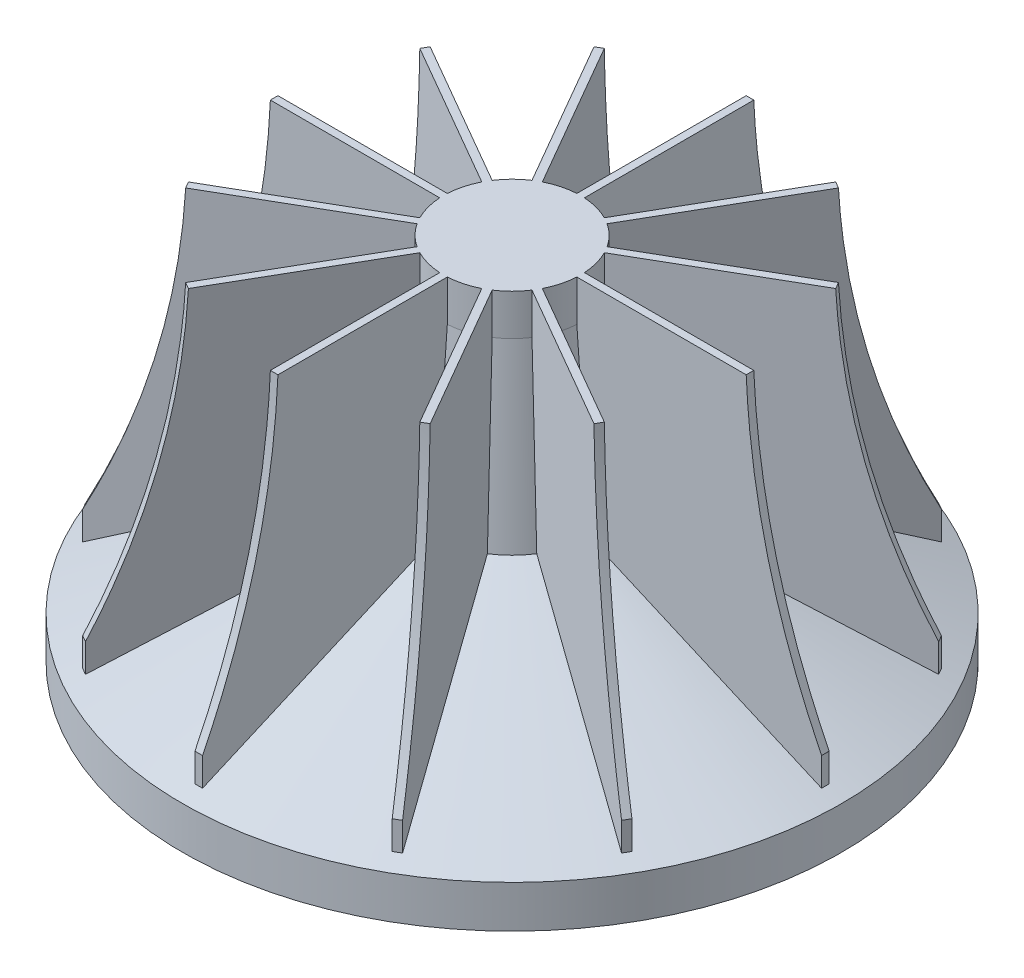
from build123d import *

# Parameters (mm, degrees)
BOSS_EXTRUDE5_REACH = 73.526
CIRPATTERN8_COUNT   = 12


with BuildPart() as part:
    # Sketch1 → Revolve1 (revolve)
    with BuildSketch(Plane.XY):
        Polygon((0, 0), (-39.624, 0), (-39.624, 5.08), (-9.822923796, 18.069281233), (-8.255, 39.518150017), (-8.255, 44.45), (0, 44.45), align=None)
    revolve(axis=Axis((0, 0, 0), (0, 1, 0)))

    # Sketch3 → Boss-Extrude5 (add, up to next)
    with BuildSketch(Plane(origin=(0, 44.45, 0), x_dir=(1, 0, 0), z_dir=(0, 1, 0)), mode=Mode.PRIVATE) as boss_extrude5_sk1:
        with BuildLine():
            Line((0.455930282, -37.670191496), (0.455991802, -8.206191496))
            add(Edge.make_bspline(
                [(-0.45593, -8.206191496), (3.0201e-05, -8.303808504), (0.455991802, -8.206191496)],
                knots=[0, 0, 0, 1, 1, 1], degree=2))
            Line((-0.45593, -8.206191496), (-0.45593, -37.670191496))
            Line((-0.45593, -37.670191496), (0.455930282, -37.670191496))
        make_face()
    boss_extrude5_tool1 = extrude(boss_extrude5_sk1.sketch, amount=-BOSS_EXTRUDE5_REACH, mode=Mode.PRIVATE) - part.part
    boss_extrude5 = boss_extrude5_tool1.solids().sort_by_distance((1.6e-05, 44.45, 22.954292))[0]
    add(boss_extrude5)

    # CirPattern8: Boss-Extrude5 ×12 about axis
    cirpattern8_axis = Axis((0, 18.069281233, 0), (0, 1, 0))
    for i in range(1, CIRPATTERN8_COUNT):
        add(boss_extrude5.rotate(cirpattern8_axis, i * 360 / CIRPATTERN8_COUNT))

    # Sketch7 → Cut-Revolve3 (revolve, cut)
    with BuildSketch(Plane(origin=(0, 0, 0), x_dir=(0, 0, -1), z_dir=(1, 0, 0))):
        with BuildLine():
            Line((-42.13340627, 53.486181243), (-28.575, 53.486181243))
            Line((-28.575, 53.486181243), (-28.575, 45.258268752))
            add(Edge.make_bspline(
                [(-28.575, 45.258268752), (-29.259976599, 26.307663759), (-37.670191496, 9.339538931)],
                knots=[0, 0, 0, 1, 1, 1], degree=2))
            Line((-37.670191496, 9.339538931), (-42.68469114, 9.339538931))
            Line((-42.68469114, 9.339538931), (-42.13340627, 53.486181243))
        make_face()
    revolve(axis=Axis((0, 0, 0), (0, 1, 0)), mode=Mode.SUBTRACT)


solid = part.part
